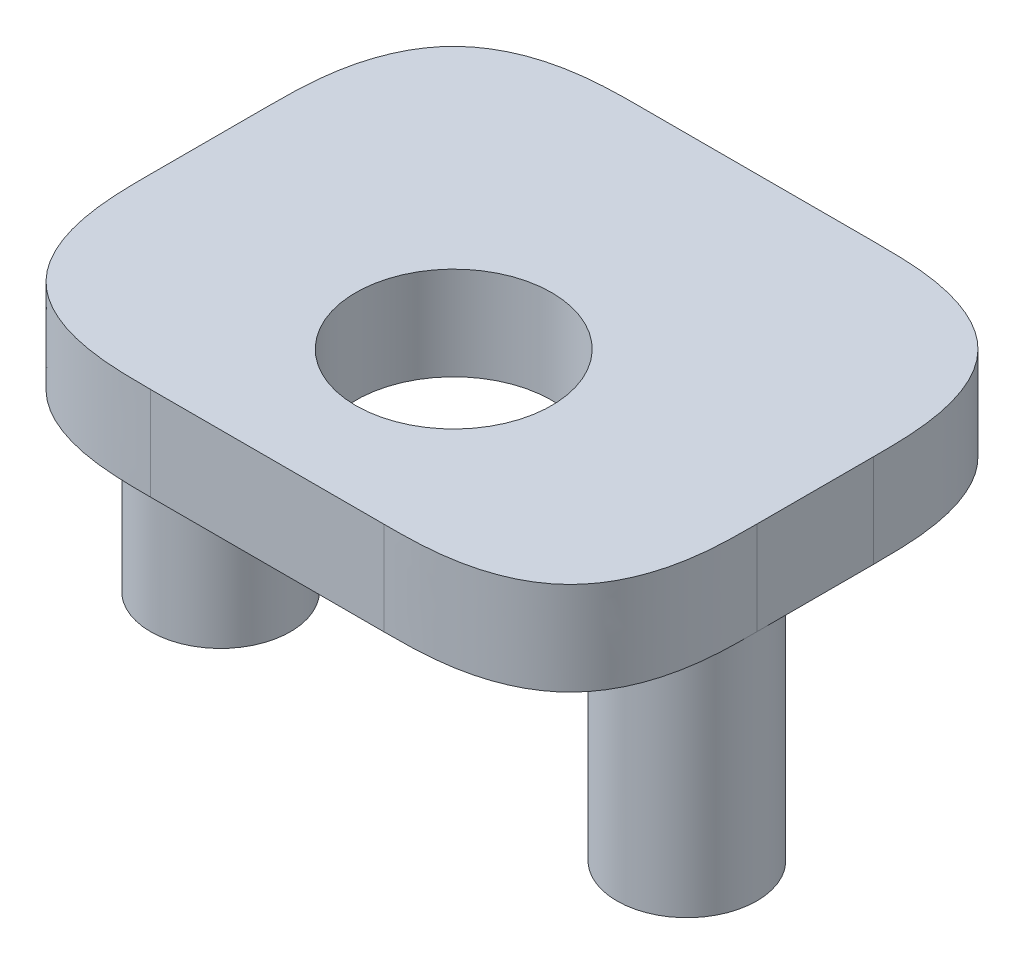
from build123d import *

# Parameters (mm, degrees)
SKETCH_1_R          = 1.5
EXTRUDE_1_DEPTH     = 5
EXTRUDE_1_2_DEPTH   = 5
EXTRUDE_1_3_DEPTH   = 5
SKETCH_2_W          = 13
SKETCH_2_H          = 10.5
EXTRUDE_6_DEPTH     = 2
SKETCH_1_6_R        = 2.1
CUT_EXTRUDE_2_DEPTH = 7
FILLET_1_SIZE       = 4
SKETCH_1_7_R        = 0.95
CUT_EXTRUDE_3_DEPTH = 6


with BuildPart() as part:
    # 草图1 → 凸台-拉伸1 (new body)
    with BuildSketch(Plane(origin=(0, 0, 0), x_dir=(1, 0, 0), z_dir=(0, 1, 0))):
        with Locations(Location((-5, 0, 0), (0, 0, 270))):
            Circle(SKETCH_1_R)
    extrude(amount=EXTRUDE_1_DEPTH)



with BuildPart() as body_2:
    # 草图1 → Extrude 1 2 (new body)
    with BuildSketch(Plane(origin=(0, 0, 0), x_dir=(1, 0, 0), z_dir=(0, 1, 0))):
        with Locations(Location((0, 5, 0), (0, 0, 270))):
            Circle(SKETCH_1_R)
    extrude(amount=EXTRUDE_1_2_DEPTH)


with BuildPart() as body_3:
    # 草图1 → Extrude 1 3 (new body)
    with BuildSketch(Plane(origin=(0, 0, 0), x_dir=(1, 0, 0), z_dir=(0, 1, 0))):
        with Locations(Location((5, 0, 0), (0, 0, 270))):
            Circle(SKETCH_1_R)
    extrude(amount=EXTRUDE_1_3_DEPTH)


with BuildPart() as part_1:
    add(part.part)

    add(body_2.part)  # 凸台-拉伸6 merges body 2

    add(body_3.part)  # 凸台-拉伸6 merges body 3
    # 草图2 → 凸台-拉伸6 (add)
    with BuildSketch(Plane(origin=(0, 5, 0), x_dir=(1, 0, 0), z_dir=(0, 1, 0))):
        with Locations((0, 1.25)):
            Rectangle(SKETCH_2_W, SKETCH_2_H)
    extrude(amount=EXTRUDE_6_DEPTH)

    # 草图1<6> → 切除-拉伸2 (cut)
    with BuildSketch(Plane(origin=(0, 0, 0), x_dir=(1, 0, 0), z_dir=(0, 1, 0))):
        with Locations(Location((0, 0, 0), (0, 0, 90))):
            Circle(SKETCH_1_6_R)
    extrude(amount=CUT_EXTRUDE_2_DEPTH, mode=Mode.SUBTRACT)

    # 圆角1
    # a fillet whose section is not a circle: 4 mm, written as the material it takes off along each edge
    with BuildSketch(Plane(origin=(6.5, -5, -6.5), x_dir=(-1, 0, 0), z_dir=(0, 1, 0)), Plane(origin=(6.5, -5, 4), x_dir=(0, 0, -1), z_dir=(0, 1, 0)), Plane(origin=(-6.5, -5, 4), x_dir=(1, 0, 0), z_dir=(0, 1, 0))) as fillet_1_piece_1:
        with BuildLine():
            add(Edge.make_bspline([(FILLET_1_SIZE, 0), (FILLET_1_SIZE * 0.831801948466, 0), (FILLET_1_SIZE * 0.663603896932, 0), (FILLET_1_SIZE * 0.292893218813, FILLET_1_SIZE * 0.0716919198361), (FILLET_1_SIZE * 0.0716919198361, FILLET_1_SIZE * 0.292893218813), (0, FILLET_1_SIZE * 0.663603896932), (0, FILLET_1_SIZE * 0.831801948466), (0, FILLET_1_SIZE)], knots=[0, 0, 0, 0, 0, 0, 0.5, 0.5, 1, 1, 1, 1, 1, 1], degree=5))
            Line((0, FILLET_1_SIZE), (0, 0))
            Line((0, 0), (FILLET_1_SIZE, 0))
        make_face()
    extrude(amount=22, mode=Mode.SUBTRACT)
    with BuildSketch(Plane(origin=(-6.5, -5, -6.5), x_dir=(1, 0, 0), z_dir=(0, 1, 0))) as fillet_1_piece_2:
        with BuildLine():
            add(Edge.make_bspline([(FILLET_1_SIZE, 0), (FILLET_1_SIZE * 0.831801948466, 0), (FILLET_1_SIZE * 0.663603896932, 0), (FILLET_1_SIZE * 0.292893218813, -FILLET_1_SIZE * 0.0716919198361), (FILLET_1_SIZE * 0.0716919198361, -FILLET_1_SIZE * 0.292893218813), (0, -FILLET_1_SIZE * 0.663603896932), (0, -FILLET_1_SIZE * 0.831801948466), (0, -FILLET_1_SIZE)], knots=[0, 0, 0, 0, 0, 0, 0.5, 0.5, 1, 1, 1, 1, 1, 1], degree=5))
            Line((0, -FILLET_1_SIZE), (0, 0))
            Line((0, 0), (FILLET_1_SIZE, 0))
        make_face()
    extrude(amount=22, mode=Mode.SUBTRACT)

    # 草图1<7> → 切除-拉伸3 (cut)
    with BuildSketch(Plane(origin=(0, 0, 0), x_dir=(1, 0, 0), z_dir=(0, 1, 0))):
        with Locations(Location((5, 0, 0), (0, 0, 270))):
            Circle(SKETCH_1_7_R)
        with Locations(Location((0, 5, 0), (0, 0, 270))):
            Circle(SKETCH_1_7_R)
        with Locations(Location((-5, 0, 0), (0, 0, 270))):
            Circle(SKETCH_1_7_R)
    extrude(amount=CUT_EXTRUDE_3_DEPTH, mode=Mode.SUBTRACT)


solid = part_1.part
